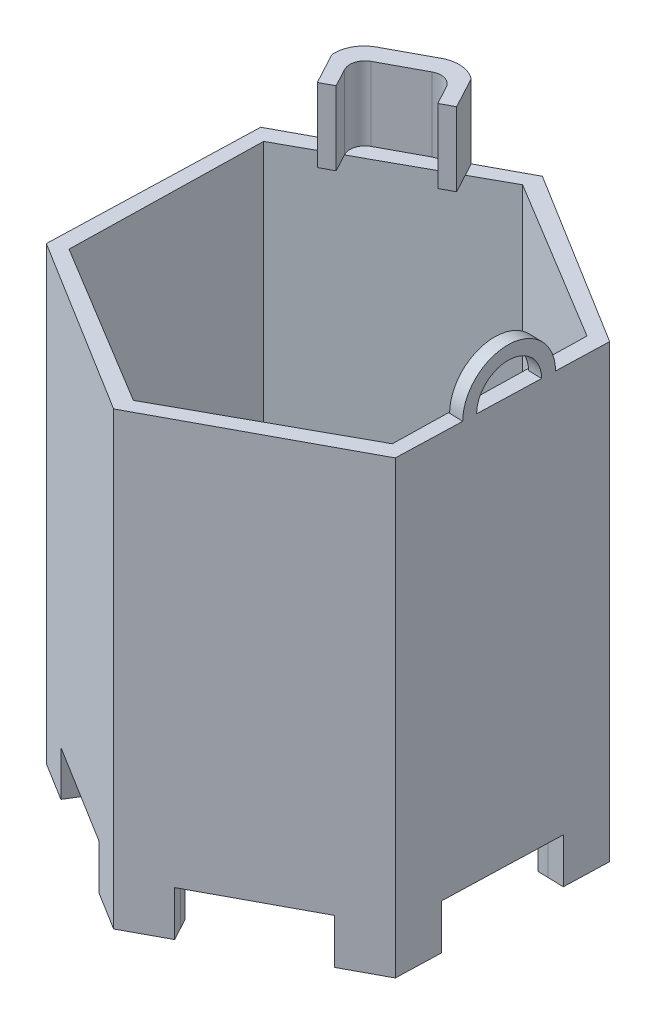
from build123d import *

# Parameters (mm, degrees)
BODY_DEPTH                 = 150
BOT_PLATE_DEPTH            = 10
SKETCH8_W                  = 39.282032303
SKETCH8_H                  = 15
LEG_1_DEPTH                = 122.011417136
SKETCH9_W                  = 39.282032302
SKETCH9_H                  = 15
LEG_2_DEPTH                = 125.337209756
SKETCH10_W                 = 39.282032303
SKETCH10_H                 = 15
LEG_3_DEPTH                = 120.609235759
F_9_0_196_DIAMETER_HOLE1_D = 4.9784
SKETCH18_W                 = 34.282032303
SKETCH18_H                 = 15
BOSS_EXTRUDE1_DEPTH        = 5.966672565
BOSS_EXTRUDE2_DEPTH        = 24.537532159
FILLET2_START              = 135
FILLET2_DEPTH              = 39.537532159
FILLET3_START              = 135
FILLET3_DEPTH              = 39.537532159
FILLET4_R                  = 10
SKETCH22_W                 = 4.63386268
SKETCH22_H                 = 24.537532159
SKETCH22_W_2               = 4.635894983
BOSS_EXTRUDE3_DEPTH        = 11.905249105
SKETCH23_R                 = 15
SKETCH23_R_2               = 10.5
BOSS_EXTRUDE4_DEPTH        = 4.5
CUT_EXTRUDE1_DEPTH         = 1
FILLET5_R                  = 5
BOSS_EXTRUDE5_DEPTH        = 20
BOSS_EXTRUDE7_DEPTH        = 20
BOSS_EXTRUDE8_DEPTH        = 20
BOSS_EXTRUDE9_DEPTH        = 20
BOSS_EXTRUDE10_DEPTH       = 20
BOSS_EXTRUDE11_DEPTH       = 20


with BuildPart() as part:
    # Sketch3 → body (new body)
    with BuildSketch(Plane(origin=(0, 0, 0), x_dir=(1, 0, 0), z_dir=(0, 1, 0))):
        Polygon((-26.246840152, 20.064679688), (-24.100311768, 89.313451633), (-82.998243261, 125.796785716), (-144.042703139, 93.031347854), (-146.189231523, 23.782575909), (-87.291300029, -12.700758174), align=None)
        Polygon((-30.815459537, 23.659426401), (-29.497763434, 87.154284541), (-83.827075542, 120.042871912), (-139.474083753, 89.436601141), (-140.791779857, 25.941743001), (-86.462467749, -6.94684437), align=None, mode=Mode.SUBTRACT)
    extrude(amount=BODY_DEPTH)

    # Sketch7 → bot plate (add)
    with BuildSketch(Plane(origin=(0, 20, 0), x_dir=(1, 0, 0), z_dir=(0, 1, 0))):
        Polygon((-30.815459537, 23.659426401), (-29.497763434, 87.154284541), (-83.827075542, 120.042871912), (-139.474083753, 89.436601141), (-140.791779857, 25.941743001), (-86.462467749, -6.94684437), align=None)
    extrude(amount=BOT_PLATE_DEPTH)

    # Sketch8 → leg 1 (cut)
    with BuildSketch(Plane(origin=(33.299538635, 0, -53.758078711), x_dir=(-0.8501184150597988, 0, -0.5265915688426999), z_dir=(0.5265915688426999, 0, -0.8501184150597988))):
        with Locations((102.160845609, 7.5)):
            Rectangle(SKETCH8_W, SKETCH8_H)
    extrude(amount=-LEG_1_DEPTH, mode=Mode.SUBTRACT)

    # Sketch9 → leg 2 (cut)
    with BuildSketch(Plane(origin=(-26.843000328, 0, -0.832061862), x_dir=(0.03098246850658078, 0, -0.9995199280880991), z_dir=(0.9995199280880991, 0, 0.03098246850658078))):
        with Locations((53.882871452, 7.5)):
            Rectangle(SKETCH9_W, SKETCH9_H)
    extrude(amount=-LEG_2_DEPTH, mode=Mode.SUBTRACT)

    # Sketch10 → leg 3 (cut)
    with BuildSketch(Plane(origin=(-70.982707514, 0, -132.246089891), x_dir=(-0.8811008835663794, 0, 0.47292835924539944), z_dir=(-0.47292835924539944, 0, -0.8811008835663794))):
        with Locations((48.277974157, 7.5)):
            Rectangle(SKETCH10_W, SKETCH10_H)
    extrude(amount=-LEG_3_DEPTH, mode=Mode.SUBTRACT)

    # #9 (0.196) Diameter Hole1 (through all)
    with Locations(Plane(origin=(0, 30, 0), x_dir=(1, 0, 0), z_dir=(0, 1, 0))):
        with Locations((-85.144878353, 56.542871912), (-85.898995371, 88.360548004), (-85.144878353, 24.80315563), (-112.654678449, 56.355962139), (-57.635318965, 56.718182868), (-112.654678449, 88.34266323), (-112.654678449, 24.80315563), (-57.635318965, 24.80315563), (-57.635318965, 88.34266323), (-98.564032754, 72.627746926), (-71.058033186, 72.631523432), (-71.058033186, 40.682224825), (-98.564032754, 40.682224825), (-130.2290882, 72.627746926), (-130.2290882, 40.682224825), (-40.178126006, 40.682224825), (-40.178126006, 72.631523432), (-85.144878353, 8.356291016), (-85.604508946, 106.005680317)):
            Hole(F_9_0_196_DIAMETER_HOLE1_D / 2)

    # Sketch18 → Boss-Extrude1 (add)
    with BuildSketch(Plane(origin=(-70.982707514, 0, -132.246089891), x_dir=(-0.8811008835663794, 0, 0.47292835924539944), z_dir=(-0.47292835924539944, 0, -0.8811008835663794))):
        with Locations((48.277974157, 142.5)):
            Rectangle(SKETCH18_W, SKETCH18_H)
    extrude(amount=BOSS_EXTRUDE1_DEPTH)

    # Sketch21 → Boss-Extrude2 (add)
    with BuildSketch(Plane(origin=(0, 150, 0), x_dir=(1, 0, 0), z_dir=(0, 1, 0))):
        Polygon((-131.445246343, 106.56483461), (-101.23931739, 122.777779898), (-98.424080215, 117.532782608), (-128.630009167, 101.31983732), align=None)
    extrude(amount=BOSS_EXTRUDE2_DEPTH)

    # Fillet2: read off the stored shape, not the designer's step
    # Fillet2 outline → Fillet2 (cut)
    with BuildSketch(Plane(origin=(0, 0, 0), x_dir=(1, 0, 0), z_dir=(0, 1, 0)).offset(FILLET2_START)):
        with BuildLine():
            ThreePointArc((-109.301860853, 118.450232937), (-103.721520164, 119.602943377), (-98.417508724, 117.520539429))
            Line((-98.417508724, 117.520539429), (-101.23931739, 122.777779898))
            Line((-101.23931739, 122.777779898), (-109.301860853, 118.450232937))
        make_face()
    extrude(amount=FILLET2_DEPTH, mode=Mode.SUBTRACT)

    # Fillet3: read off the stored shape, not the designer's step
    # Fillet3 outline → Fillet3 (cut)
    with BuildSketch(Plane(origin=(0, 0, 0), x_dir=(1, 0, 0), z_dir=(0, 1, 0)).offset(FILLET3_START)):
        with BuildLine():
            Line((-131.445246343, 106.56483461), (-128.623437676, 101.307594141))
            ThreePointArc((-128.623437676, 101.307594141), (-127.427495148, 106.878829644), (-123.382702879, 110.892381571))
            Line((-123.382702879, 110.892381571), (-131.445246343, 106.56483461))
        make_face()
    extrude(amount=FILLET3_DEPTH, mode=Mode.SUBTRACT)

    # Fillet4
    # the kernel refuses this fillet: 10 mm, written as the material it takes off along each edge
    with BuildSketch(Plane(origin=(-143.539061537, 135, -100.073514167), x_dir=(0.4729283592453995, 0, 0.8811008835663794), z_dir=(0.8811008835663794, 0, -0.47292835924539944))) as fillet4_piece_1:
        with BuildLine():
            CenterArc((10, -9.150533853), FILLET4_R, 113.786690389, 66.213309611)
            Line((0, -9.150533853), (0, 0))
            Line((0, 0), (5.966672565, 0))
        make_face()
    extrude(amount=61.733633863, mode=Mode.SUBTRACT)

    # Sketch22 → Boss-Extrude3 (add)
    with BuildSketch(Plane(origin=(-70.989279005, 0, -132.258333069), x_dir=(0.8811008835663795, 0, -0.47292835924539944), z_dir=(0.47292835924539944, 0, 0.8811008835663795))):
        with Locations((-63.095921648, 162.26876608)):
            Rectangle(SKETCH22_W, SKETCH22_H)
        with Locations((-33.461042817, 162.26876608)):
            Rectangle(SKETCH22_W_2, SKETCH22_H)
    extrude(amount=BOSS_EXTRUDE3_DEPTH)

    # Sketch23 → Boss-Extrude4 (add)
    with BuildSketch(Plane(origin=(-26.843000328, 0, -0.832061862), x_dir=(0.03098246850658078, 0, -0.9995199280880991), z_dir=(0.9995199280880991, 0, 0.03098246850658078))):
        with Locations((56.023887603, 150)):
            Circle(SKETCH23_R)
        with Locations((56.023887603, 150)):
            Circle(SKETCH23_R_2, mode=Mode.SUBTRACT)
    extrude(amount=-BOSS_EXTRUDE4_DEPTH)

    # Sketch24 → Cut-Extrude1 (cut)
    # profile 1 of 8: a face of its own
    with BuildSketch(Plane(origin=(-70.982707514, 0, -132.246089891), x_dir=(-0.8811008835663794, 0, 0.47292835924539944), z_dir=(-0.47292835924539944, 0, -0.8811008835663794))):
        Polygon((37.901855727, 33.412733714), (38.226475118, 33.412733714), (38.911471112, 30.845926823), (39.93020108, 33.412733714), (39.975773997, 33.412733714), (40.975573676, 30.863454868), (41.664075279, 33.412733714), (41.985189061, 33.412733714), (41.041479125, 29.912733714), (40.99660733, 29.912733714), (39.943522394, 32.589616727), (38.877817266, 29.912733714), (38.832945471, 29.912733714), align=None)
    # profile 2 of 8: a face of its own
    with BuildSketch(Plane(origin=(-70.982707514, 0, -132.246089891), x_dir=(-0.8811008835663794, 0, 0.47292835924539944), z_dir=(-0.47292835924539944, 0, -0.8811008835663794))):
        Polygon((42.613394189, 33.412733714), (42.927496753, 33.412733714), (42.927496753, 30.271708073), (44.273650599, 30.271708073), (44.273650599, 29.912733714), (42.613394189, 29.912733714), align=None)
    # profile 3 of 8: a face of its own
    with BuildSketch(Plane(origin=(-70.982707514, 0, -132.246089891), x_dir=(-0.8811008835663794, 0, 0.47292835924539944), z_dir=(-0.47292835924539944, 0, -0.8811008835663794))):
        with BuildLine():
            Line((48.132624958, 32.815377945), (47.863394189, 32.560169611))
            add(Edge.make_bspline(
                [(47.863394189, 32.560169611), (47.814675301, 32.606000474), (47.718399254, 32.696569337), (47.561439012, 32.814080332), (47.397675378, 32.914746433), (47.227962881, 32.996652669), (47.056504327, 33.06200543), (46.885575551, 33.10853357), (46.716929849, 33.138206107), (46.604762631, 33.141754477), (46.549491945, 33.143502945)],
                knots=[0, 0, 0, 0, 1.08915593, 2.152340314, 3.188132944, 4.216796309, 5.218260357, 6.173443236, 7.099959455, 8, 8, 8, 8], degree=3))
            add(Edge.make_bspline(
                [(46.549491945, 33.143502945), (46.515577245, 33.143089339), (46.447835805, 33.1422632), (46.347213861, 33.131718984), (46.247647224, 33.11655412), (46.149323849, 33.094612243), (46.052052563, 33.066803183), (45.95617167, 33.03201772), (45.861502316, 32.991462476), (45.768936235, 32.944600002), (45.679195731, 32.893120156), (45.594438895, 32.836071615), (45.514125497, 32.775282825), (45.439765071, 32.709231846), (45.370929885, 32.63851698), (45.305981513, 32.564453674), (45.247204217, 32.485018456), (45.194113052, 32.40167283), (45.146751433, 32.31588064), (45.10494278, 32.228467651), (45.069845692, 32.139723796), (45.042076236, 32.049537719), (45.019165583, 31.958607129), (45.003047975, 31.866302408), (44.993961253, 31.772524723), (44.992389473, 31.709727464), (44.991599317, 31.678158393)],
                knots=[0, 0, 0, 0, 1.02818874, 2.053710826, 3.065248034, 4.081641283, 5.106893873, 6.131558223, 7.173050175, 8.228653731, 9.27666206, 10.308777013, 11.325269123, 12.329503258, 13.32196095, 14.316845687, 15.314881793, 16.315733098, 17.311955233, 18.285320748, 19.252783886, 20.203351036, 21.145449891, 22.095197417, 23.042428769, 24, 24, 24, 24], degree=3))
            add(Edge.make_bspline(
                [(44.991599317, 31.678158393), (44.992355035, 31.645887576), (44.993864408, 31.581434063), (45.003524728, 31.48523999), (45.021452968, 31.390474588), (45.045420677, 31.296826455), (45.075401493, 31.204135207), (45.112774159, 31.112802697), (45.15703976, 31.022832306), (45.208276312, 30.935034689), (45.264462515, 30.849511665), (45.327405596, 30.768952144), (45.394266179, 30.692283366), (45.467480079, 30.621207602), (45.544699622, 30.553823706), (45.628231898, 30.491988184), (45.716434358, 30.434509961), (45.80944157, 30.382113442), (45.906244352, 30.335304906), (46.005501105, 30.29368101), (46.107528921, 30.259401673), (46.211791611, 30.231463569), (46.318164882, 30.208563271), (46.427188685, 30.193830791), (46.538061393, 30.18313996), (46.612800026, 30.18235829), (46.650453484, 30.181964483)],
                knots=[0, 0, 0, 0, 0.93586088, 1.869166235, 2.799637598, 3.729985548, 4.670839027, 5.622275134, 6.589130586, 7.576015415, 8.568469353, 9.55398029, 10.53834874, 11.515998671, 12.510579167, 13.508179873, 14.527009472, 15.561807829, 16.601455013, 17.643573243, 18.680854198, 19.719860599, 20.772568776, 21.833555941, 22.908541556, 24, 24, 24, 24], degree=3))
            add(Edge.make_bspline(
                [(46.650453484, 30.181964483), (46.695831831, 30.182913059), (46.784939588, 30.184775743), (46.915926031, 30.199276033), (47.041729102, 30.221922826), (47.161995305, 30.255088723), (47.276864326, 30.297392398), (47.386757267, 30.348387784), (47.490808926, 30.410030843), (47.589332099, 30.479604711), (47.680089285, 30.557119543), (47.761943409, 30.640763998), (47.833588898, 30.730132065), (47.896093597, 30.82469738), (47.947802252, 30.925242685), (47.990245047, 31.031275248), (48.022778338, 31.14284276), (48.036133313, 31.219934391), (48.042881368, 31.25888756)],
                knots=[0, 0, 0, 0, 1.13008108, 2.219097802, 3.278683437, 4.311054135, 5.322181354, 6.324827112, 7.324222904, 8.330512327, 9.32562643, 10.293043162, 11.24128371, 12.174520618, 13.111833804, 14.052305215, 15.015860969, 16, 16, 16, 16], degree=3))
            Line((48.042881368, 31.25888756), (46.876214702, 31.25888756))
            Line((46.876214702, 31.25888756), (46.876214702, 31.617861919))
            Line((46.876214702, 31.617861919), (48.356983933, 31.617861919))
            add(Edge.make_bspline(
                [(48.356983933, 31.617861919), (48.355278084, 31.55095443), (48.351939431, 31.420004388), (48.328520515, 31.229034118), (48.290704003, 31.048662424), (48.239043691, 30.878699353), (48.172168411, 30.71938576), (48.090795882, 30.570559894), (47.993623761, 30.433183213), (47.88411332, 30.306134209), (47.761213362, 30.192804997), (47.628244742, 30.093199059), (47.484987774, 30.009296444), (47.331577966, 29.941035781), (47.168517533, 29.887761787), (46.995429153, 29.84999021), (46.812547552, 29.827360246), (46.687210875, 29.824468867), (46.623109734, 29.822990124)],
                knots=[0, 0, 0, 0, 1.140356446, 2.231883559, 3.274166699, 4.278491846, 5.25512956, 6.21435461, 7.1637429, 8.11826594, 9.068280886, 10.0076534, 10.945064095, 11.891975133, 12.864533718, 13.863980011, 14.907571808, 16, 16, 16, 16], degree=3))
            add(Edge.make_bspline(
                [(46.623109734, 29.822990124), (46.583599598, 29.823559245), (46.505672878, 29.824681736), (46.39058195, 29.832659083), (46.278664329, 29.84493966), (46.16993632, 29.863484783), (46.063997978, 29.886199437), (45.961378393, 29.915286156), (45.861686651, 29.948954855), (45.764768665, 29.987250529), (45.671504119, 30.031622186), (45.581477602, 30.080931825), (45.494191476, 30.134925186), (45.410240311, 30.194536032), (45.329186689, 30.259318492), (45.251553246, 30.329402411), (45.176905368, 30.40457353), (45.130144904, 30.45795254), (45.106583292, 30.484849099)],
                knots=[0, 0, 0, 0, 1.107784379, 2.184907829, 3.233506516, 4.263428166, 5.276301166, 6.270063455, 7.25232949, 8.225834625, 9.190232166, 10.146266622, 11.1027726, 12.066435141, 13.031522626, 14.010570082, 14.99756817, 16, 16, 16, 16], degree=3))
            add(Edge.make_bspline(
                [(45.106583292, 30.484849099), (45.07239736, 30.527519752), (45.004592947, 30.612152769), (44.91731479, 30.747752713), (44.842913388, 30.888154573), (44.782545565, 31.033749202), (44.735407479, 31.184400415), (44.701601226, 31.339915706), (44.681793937, 31.500495336), (44.6789404, 31.609160601), (44.677496753, 31.664135958)],
                knots=[0, 0, 0, 0, 1.023165419, 2.029347347, 3.013907458, 3.994755782, 4.975994455, 5.96558838, 6.970761222, 8, 8, 8, 8], degree=3))
            add(Edge.make_bspline(
                [(44.677496753, 31.664135958), (44.678028991, 31.70530221), (44.679086703, 31.787111518), (44.691912219, 31.908568825), (44.710313637, 32.027869517), (44.737360692, 32.144916074), (44.771456957, 32.259786665), (44.814010443, 32.372534629), (44.863555339, 32.483226501), (44.921140835, 32.591100369), (44.985225294, 32.694724782), (45.054775514, 32.793682585), (45.130779115, 32.88617165), (45.211994914, 32.973363298), (45.299391904, 33.054162145), (45.392151328, 33.129316256), (45.490344671, 33.198926442), (45.594280851, 33.261896276), (45.702408535, 33.318459897), (45.814468537, 33.368049109), (45.930426648, 33.409032424), (46.049414125, 33.443806204), (46.172331626, 33.469521344), (46.298287163, 33.48817009), (46.427937275, 33.500930689), (46.515573304, 33.501956945), (46.560008772, 33.502477304)],
                knots=[0, 0, 0, 0, 1.008945113, 2.00506715, 2.99143336, 3.967273523, 4.948097931, 5.927297278, 6.919902385, 7.919676788, 8.923139349, 9.905703106, 10.883022732, 11.856032218, 12.825136022, 13.798837087, 14.781400844, 15.773989409, 16.776158564, 17.77167057, 18.775803737, 19.789618931, 20.80898985, 21.851988756, 22.910860228, 24, 24, 24, 24], degree=3))
            add(Edge.make_bspline(
                [(46.560008772, 33.502477304), (46.596247016, 33.501897812), (46.668103195, 33.500748748), (46.775028927, 33.4927841), (46.880301942, 33.480160219), (46.984078332, 33.462933432), (47.086004698, 33.439469742), (47.186371403, 33.411391457), (47.285323939, 33.378699634), (47.382552189, 33.339710788), (47.478709905, 33.295457163), (47.574331745, 33.245643741), (47.669090991, 33.189418736), (47.763151973, 33.126615201), (47.85710783, 33.058311783), (47.949472473, 32.982554959), (48.042475417, 32.902332203), (48.102277231, 32.844650019), (48.132624958, 32.815377945)],
                knots=[0, 0, 0, 0, 0.985871117, 1.954866573, 2.915460327, 3.869826059, 4.81536089, 5.759505086, 6.70452669, 7.649098992, 8.607881297, 9.583363685, 10.581137262, 11.603961102, 12.659522466, 13.73993555, 14.853081303, 16, 16, 16, 16], degree=3))
        make_face()
    # profile 4 of 8: a face of its own
    with BuildSketch(Plane(origin=(-70.982707514, 0, -132.246089891), x_dir=(-0.8811008835663794, 0, 0.47292835924539944), z_dir=(-0.47292835924539944, 0, -0.8811008835663794))):
        Polygon((48.805701881, 33.412733714), (49.165377362, 33.412733714), (50.085249157, 31.908827464), (51.003718708, 33.412733714), (51.363394189, 33.412733714), (50.241599317, 31.576495733), (50.241599317, 29.912733714), (49.927496753, 29.912733714), (49.927496753, 31.576495733), align=None)
    # profile 5 of 8: a face of its own
    with BuildSketch(Plane(origin=(-70.982707514, 0, -132.246089891), x_dir=(-0.8811008835663794, 0, 0.47292835924539944), z_dir=(-0.47292835924539944, 0, -0.8811008835663794))):
        Polygon((51.991599317, 33.412733714), (52.305701881, 33.412733714), (52.305701881, 30.271708073), (53.651855727, 30.271708073), (53.651855727, 29.912733714), (51.991599317, 29.912733714), align=None)
    # profile 6 of 8: a face of its own
    with BuildSketch(Plane(origin=(-70.982707514, 0, -132.246089891), x_dir=(-0.8811008835663794, 0, 0.47292835924539944), z_dir=(-0.47292835924539944, 0, -0.8811008835663794))):
        with BuildLine():
            Line((40.728778804, 23.079400381), (40.728778804, 26.66914397))
            Line((40.728778804, 26.66914397), (41.042881368, 26.66914397))
            Line((41.042881368, 26.66914397), (41.042881368, 25.17295006))
            add(Edge.make_bspline(
                [(41.042881368, 25.17295006), (41.078274787, 25.213707992), (41.147328807, 25.293228397), (41.263105258, 25.397076047), (41.384510828, 25.485128524), (41.512469084, 25.557714643), (41.647162017, 25.61298825), (41.787894125, 25.65341064), (41.935025166, 25.677797543), (42.03534434, 25.680563616), (42.086150599, 25.681964483)],
                knots=[0, 0, 0, 0, 1.077089805, 2.101446609, 3.097517232, 4.067117542, 5.031729543, 5.997785507, 6.985986182, 8, 8, 8, 8], degree=3))
            add(Edge.make_bspline(
                [(42.086150599, 25.681964483), (42.131316737, 25.680724255), (42.220617889, 25.678272113), (42.351900036, 25.659637617), (42.478213311, 25.629419815), (42.599488959, 25.587527636), (42.715161092, 25.531944659), (42.826220149, 25.465403351), (42.932097133, 25.386165022), (43.031152019, 25.295566711), (43.122445905, 25.197210088), (43.202358415, 25.092029773), (43.269858111, 24.981554682), (43.325689404, 24.86615462), (43.368860457, 24.745358269), (43.398602724, 24.61928407), (43.417496188, 24.488056052), (43.419876434, 24.398743248), (43.421086497, 24.353338682)],
                knots=[0, 0, 0, 0, 1.034377878, 2.045141349, 3.03070803, 4.00595497, 4.978199603, 5.965204761, 6.967410914, 8.002051993, 9.036360596, 10.037508045, 11.022711142, 11.997267194, 12.969246472, 13.954813154, 14.960274251, 16, 16, 16, 16], degree=3))
            add(Edge.make_bspline(
                [(43.421086497, 24.353338682), (43.419850056, 24.308638664), (43.41741199, 24.220497269), (43.398790682, 24.090790713), (43.368044417, 23.965952014), (43.324083234, 23.846303756), (43.268818295, 23.731283843), (43.19970702, 23.622203439), (43.11989602, 23.517164463), (43.027564872, 23.419540832), (42.927651319, 23.329307432), (42.820737076, 23.250901566), (42.709515154, 23.183184446), (42.592252042, 23.129528999), (42.470684001, 23.086128077), (42.343508614, 23.056010387), (42.211445386, 23.038437332), (42.121726497, 23.035841765), (42.076334894, 23.034528586)],
                knots=[0, 0, 0, 0, 1.024244038, 2.01964794, 2.996620209, 3.965911562, 4.936179293, 5.91563013, 6.920572822, 7.955171681, 8.990768464, 10.002129126, 10.989675881, 11.969873457, 12.952483066, 13.943799762, 14.959703725, 16, 16, 16, 16], degree=3))
            add(Edge.make_bspline(
                [(42.076334894, 23.034528586), (42.024369782, 23.035969194), (41.922475257, 23.038793976), (41.773422592, 23.062212955), (41.632341043, 23.102074565), (41.497623494, 23.155636321), (41.371195771, 23.228164975), (41.252255189, 23.318121725), (41.141551816, 23.426988862), (41.076335001, 23.510050351), (41.042881368, 23.552657592)],
                knots=[0, 0, 0, 0, 1.035807596, 2.031038093, 2.998900396, 3.954262848, 4.914341711, 5.895762244, 6.92060972, 8, 8, 8, 8], degree=3))
            Line((41.042881368, 23.552657592), (41.042881368, 23.079400381))
            Line((41.042881368, 23.079400381), (40.728778804, 23.079400381))
        make_face()
        with BuildLine():
            add(Edge.make_bspline(
                [(42.073530407, 23.34863115), (42.119444759, 23.350264779), (42.210072388, 23.353489302), (42.343116179, 23.378662925), (42.470430388, 23.420547039), (42.59137347, 23.477830748), (42.704052782, 23.549852782), (42.804705416, 23.636998953), (42.894185126, 23.736500468), (42.968836902, 23.848734161), (43.031163146, 23.96818513), (43.073976423, 24.093839431), (43.102696144, 24.22233422), (43.105548442, 24.309480265), (43.106983933, 24.353338682)],
                knots=[0, 0, 0, 0, 1.031910345, 2.036826888, 3.032245421, 4.038315463, 5.03827337, 6.029480047, 7.023177075, 8.037597977, 9.052889626, 10.043399556, 11.015292101, 12, 12, 12, 12], degree=3))
            add(Edge.make_bspline(
                [(43.106983933, 24.353338682), (43.105096189, 24.397154224), (43.101328237, 24.484610385), (43.074953455, 24.614260052), (43.028895665, 24.739847677), (42.967777642, 24.861025665), (42.891909656, 24.974033466), (42.802903693, 25.075523593), (42.701021887, 25.163083577), (42.588198467, 25.236073648), (42.468018277, 25.295633201), (42.341527643, 25.336478226), (42.21136952, 25.363216414), (42.122974027, 25.366305542), (42.078438259, 25.367861919)],
                knots=[0, 0, 0, 0, 0.984795267, 1.965658976, 2.959410029, 3.983795688, 5.009594896, 6.01088574, 7.009236619, 8.019050059, 9.024672985, 10.014834719, 10.999826153, 12, 12, 12, 12], degree=3))
            add(Edge.make_bspline(
                [(42.078438259, 25.367861919), (42.032970752, 25.366306422), (41.942726976, 25.363219075), (41.809558753, 25.336431251), (41.67949547, 25.295383639), (41.555207938, 25.23645229), (41.439353882, 25.164340829), (41.33574127, 25.07960063), (41.246409712, 24.982820722), (41.172865942, 24.87431492), (41.114461143, 24.757129885), (41.072677395, 24.632117681), (41.047677748, 24.499936369), (41.044499616, 24.409303163), (41.042881368, 24.363154387)],
                knots=[0, 0, 0, 0, 1.016820015, 2.018181405, 3.029022337, 4.06341356, 5.088169224, 6.076823655, 7.05054209, 8.02560866, 9.001194327, 9.972267242, 10.967515442, 12, 12, 12, 12], degree=3))
            add(Edge.make_bspline(
                [(41.042881368, 24.363154387), (41.043841039, 24.327816569), (41.045729974, 24.258260559), (41.060160343, 24.156132868), (41.083116004, 24.058399776), (41.115459498, 23.964954781), (41.157960733, 23.876328341), (41.209170999, 23.791832261), (41.270122645, 23.712228983), (41.339029235, 23.637713662), (41.414991615, 23.569904248), (41.496514734, 23.511126023), (41.581932665, 23.460511833), (41.672222636, 23.42016699), (41.766333926, 23.387240469), (41.865232267, 23.365506724), (41.967903692, 23.350531685), (42.037950789, 23.349271332), (42.073530407, 23.34863115)],
                knots=[0, 0, 0, 0, 1.050331198, 2.067384183, 3.060053655, 4.031335885, 5.001026174, 5.976994447, 6.963687968, 7.976578778, 8.990422448, 9.985569286, 10.960374351, 11.936812464, 12.921228065, 13.919088064, 14.943024695, 16, 16, 16, 16], degree=3))
        make_face(mode=Mode.SUBTRACT)
    # profile 7 of 8: a face of its own
    with BuildSketch(Plane(origin=(-70.982707514, 0, -132.246089891), x_dir=(-0.8811008835663794, 0, 0.47292835924539944), z_dir=(-0.47292835924539944, 0, -0.8811008835663794))):
        Polygon((43.780060856, 25.637092688), (44.118702683, 25.637092688), (44.984588099, 23.678158393), (45.86379483, 25.637092688), (46.203137779, 25.637092688), (44.632624958, 22.137092688), (44.293282009, 22.137092688), (44.814215503, 23.297449259), align=None)
    # profile 8 of 8: a face of its own
    with BuildSketch(Plane(origin=(-70.982707514, 0, -132.246089891), x_dir=(-0.8811008835663794, 0, 0.47292835924539944), z_dir=(-0.47292835924539944, 0, -0.8811008835663794))):
        Polygon((48.042881368, 26.579400381), (48.356983933, 26.579400381), (48.356983933, 25.143502945), (50.151855727, 25.143502945), (50.151855727, 26.579400381), (50.465958292, 26.579400381), (50.465958292, 23.079400381), (50.151855727, 23.079400381), (50.151855727, 24.784528586), (48.356983933, 24.784528586), (48.356983933, 23.079400381), (48.042881368, 23.079400381), align=None)
    extrude(amount=-CUT_EXTRUDE1_DEPTH, mode=Mode.SUBTRACT)

    # Fillet5
    # the kernel refuses this fillet: 5 mm, written as the material it adds along each edge
    with BuildSketch(Plane(origin=(-124.541701067, 174.537532159, -103.514224907), x_dir=(0.8811008835663761, 0, -0.47292835924540544), z_dir=(0, -1, 0))) as fillet5_piece_1:
        with BuildLine():
            CenterArc((FILLET5_R, FILLET5_R), FILLET5_R, 180, 90)
            Line((0, FILLET5_R), (0, 0))
            Line((0, 0), (FILLET5_R, 0))
        make_face()
    extrude(amount=37.037532159)
    with BuildSketch(Plane(origin=(-102.514178978, 174.537532159, -115.337433888), x_dir=(-0.8811008835663815, 0, 0.4729283592453954), z_dir=(0, -1, 0))) as fillet5_piece_2:
        with BuildLine():
            CenterArc((FILLET5_R, -FILLET5_R), FILLET5_R, 90, 90)
            Line((0, -FILLET5_R), (0, 0))
            Line((0, 0), (FILLET5_R, 0))
        make_face()
    extrude(amount=24.537532159)

    # Sketch26 → Boss-Extrude5 (add)
    with BuildSketch(Plane.XZ.offset(-20)):
        Polygon((-97.305747097, 0.3827977), (-86.462467749, 6.94684437), (-76.342967093, 1.381043313), (-78.194380894, -1.985117816), (-86.462467749, 2.562391802), (-95.508489719, -2.586127536), align=None)
    extrude(amount=BOSS_EXTRUDE5_DEPTH)

    # Sketch30 → Boss-Extrude7 (add)
    with BuildSketch(Plane.XZ.offset(-20)):
        Polygon((-41.860444867, -17.538732936), (-30.756306981, -23.651141425), (-30.520712315, -35.197869536), (-34.361627856, -35.276237989), (-34.554119287, -25.842042156), (-43.534042238, -20.57908209), align=None)
    extrude(amount=BOSS_EXTRUDE7_DEPTH)

    # Sketch31 → Boss-Extrude8 (add)
    with BuildSketch(Plane.XZ.offset(-20)):
        Polygon((-29.760423455, -74.48554208), (-29.497431962, -87.158120791), (-39.377307397, -93.138964904), (-41.366781547, -89.852512956), (-33.294479267, -84.965894507), (-33.23021682, -74.557550009), align=None)
    extrude(amount=BOSS_EXTRUDE8_DEPTH)

    # Sketch32 → Boss-Extrude9 (add)
    with BuildSketch(Plane.XZ.offset(-20)):
        Polygon((-140.576246067, -38.613998875), (-140.839237561, -25.941420165), (-130.959362125, -19.960576052), (-128.969887975, -23.247028), (-137.042190255, -28.133646449), (-137.106452702, -38.541990947), align=None)
    extrude(amount=BOSS_EXTRUDE9_DEPTH)

    # Sketch36 → Boss-Extrude10 (add)
    with BuildSketch(Plane.XZ.offset(-20)):
        Polygon((-72.982426188, -113.501141755), (-83.825705536, -120.065188425), (-93.945206191, -114.499387368), (-92.093792391, -111.133226239), (-83.825705536, -115.680735857), (-74.779683565, -110.532216519), align=None)
    extrude(amount=BOSS_EXTRUDE10_DEPTH)

    # Sketch37 → Boss-Extrude11 (add)
    with BuildSketch(Plane.XZ.offset(-20)):
        Polygon((-128.429170958, -95.562630822), (-139.533308843, -89.450222333), (-139.768903509, -77.903494222), (-135.927987968, -77.825125769), (-135.735496538, -87.259321602), (-126.755573587, -92.522281668), align=None)
    extrude(amount=BOSS_EXTRUDE11_DEPTH)


solid = part.part
